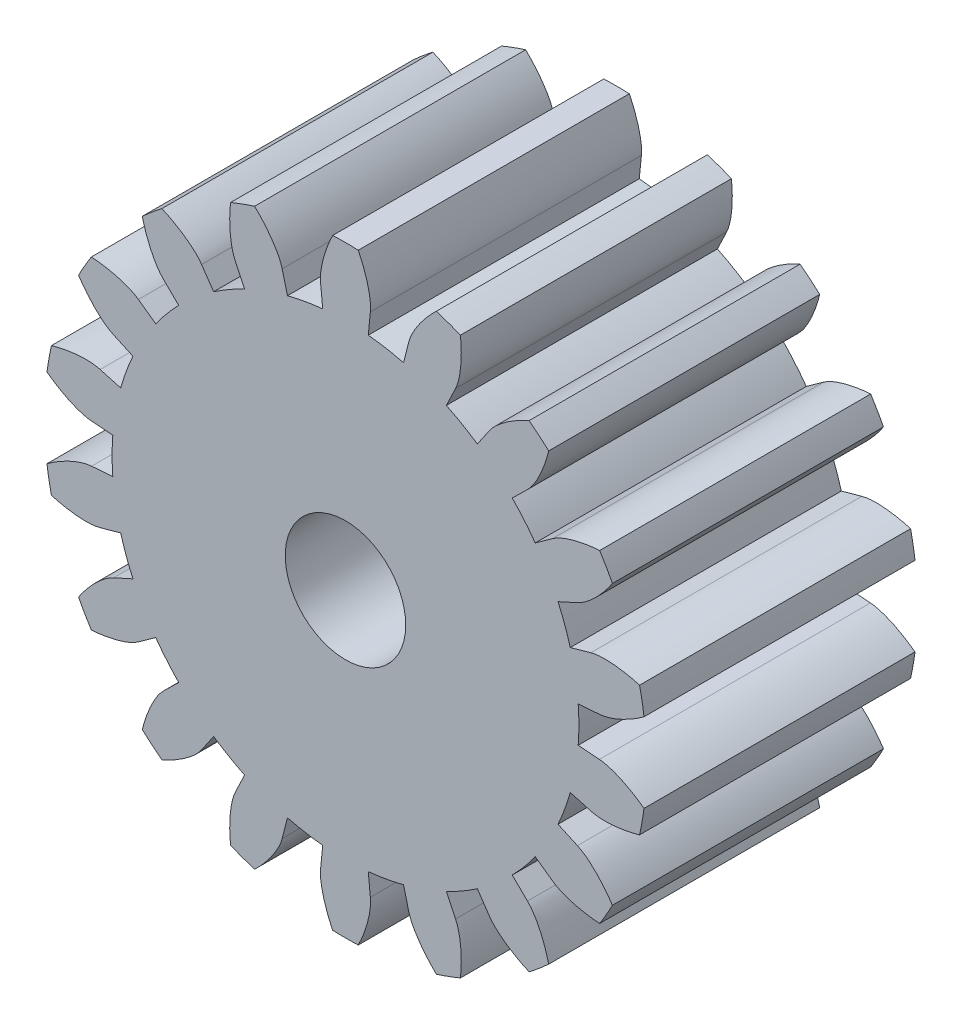
from build123d import *

# Parameters (mm, degrees)
SKETCH_1_R               = 5
SKETCH_1_R_2             = 1
EXTRUDE_1_DEPTH          = 4.5
CUT_EXTRUDE_1_DEPTH      = 9.381527307
PATTERN_CIRCULAR_1_COUNT = 18
PATTERN_CIRCULAR_1_ANGLE = 340


with BuildPart() as part:
    # 草图1 → 凸台-拉伸1 (new body)
    with BuildSketch(Plane.XY):
        Circle(SKETCH_1_R)
        Circle(SKETCH_1_R_2, mode=Mode.SUBTRACT)
    extrude(amount=EXTRUDE_1_DEPTH)

    # 草图1<3> → 切除-拉伸1 (cut, through all)
    with BuildSketch(Plane.XY):
        with BuildLine():
            Line((4.216167683, 0.324237649), (3.863591943, 0.297123374))
            ThreePointArc((3.863591943, 0.297123374), (3.872146935, 0.14867115), (3.875, 0))
            ThreePointArc((3.875, 0), (3.872146935, -0.14867115), (3.863591943, -0.297123374))
            Line((3.863591943, -0.297123374), (4.216167683, -0.324237649))
            add(Edge.make_bspline(
                [(4.216167683, -0.324237649), (4.248306389, -0.326709225), (4.337481239, -0.340286167), (4.502360973, -0.392611203), (4.68808741, -0.481175676), (4.835513121, -0.572403241), (4.929530291, -0.638831397), (4.956443154, -0.658537214)],
                knots=[0, 0, 0, 0, 0, 0.005604068, 0.015718248, 0.029959916, 0.035770965, 0.035770965, 0.035770965, 0.035770965, 0.035770965], degree=4))
            ThreePointArc((4.956443154, -0.658537214), (4.989098905, -0.329988053), (5, 0))
            ThreePointArc((5, 0), (4.989098905, 0.329988053), (4.956443154, 0.658537214))
            add(Edge.make_bspline(
                [(4.216167683, 0.324237649), (4.248306389, 0.326709225), (4.337481239, 0.340286167), (4.502360973, 0.392611203), (4.68808741, 0.481175676), (4.835513121, 0.572403241), (4.929530291, 0.638831397), (4.956443154, 0.658537214)],
                knots=[0, 0, 0, 0, 0, 0.005604068, 0.015718248, 0.029959916, 0.035770965, 0.035770965, 0.035770965, 0.035770965, 0.035770965], degree=4))
        make_face()
    cut_extrude_1 = extrude(amount=CUT_EXTRUDE_1_DEPTH, mode=Mode.SUBTRACT)

    # 阵列(圆周)1: 切除-拉伸1 ×18 about axis
    pattern_circular_1_axis = Axis((0, 0, 4.5), (0, 0, 1))
    for i in range(1, PATTERN_CIRCULAR_1_COUNT):
        add(cut_extrude_1.rotate(pattern_circular_1_axis, i * PATTERN_CIRCULAR_1_ANGLE / (PATTERN_CIRCULAR_1_COUNT - 1)), mode=Mode.SUBTRACT)


solid = part.part
